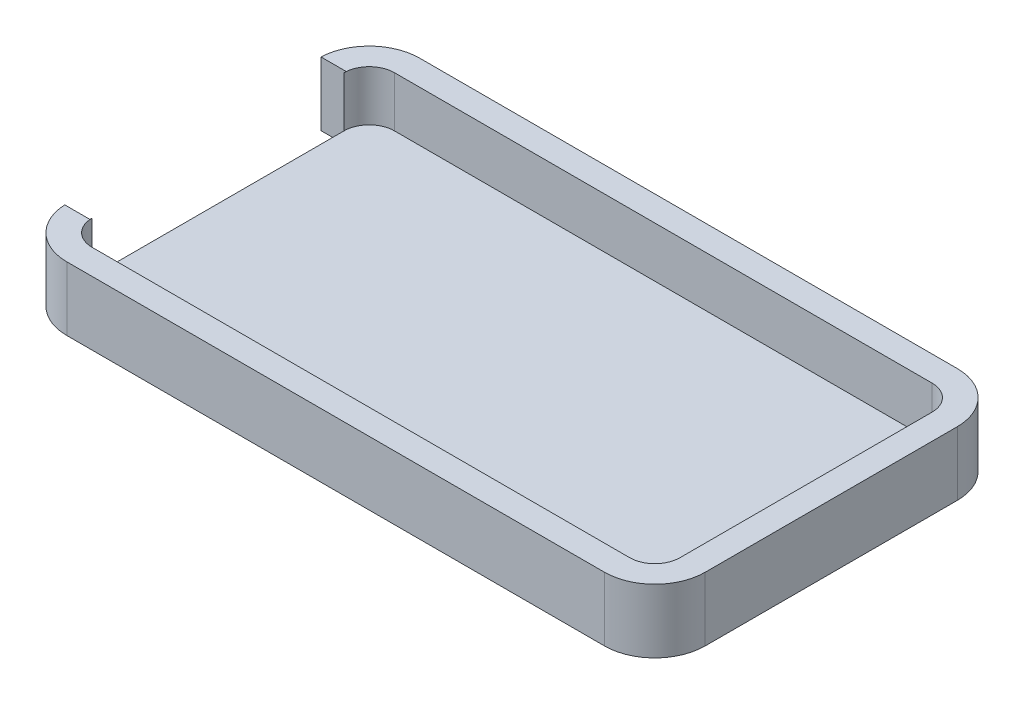
from build123d import *

# Parameters (mm, degrees)
EXTRUDE_3_DEPTH     = 3
EXTRUDE_START       = 0.8
EXTRUDE_4_DEPTH     = 0.8
SKETCH_4_W          = 3
SKETCH_4_H          = 15.25
CUT_EXTRUDE_1_DEPTH = 4


with BuildPart() as part:
    # 草图1 → 凸台-拉伸3 (new body)
    with BuildSketch(Plane(origin=(0, 0, 0), x_dir=(1, 0, 0), z_dir=(0, 1, 0))):
        with BuildLine():
            Line((16, 10.5), (-16, 10.5))
            ThreePointArc((-16, 10.5), (-18.121320344, 9.621320344), (-19, 7.5))
            Line((-19, 7.5), (-19, -7.5))
            ThreePointArc((-19, -7.5), (-18.121320344, -9.621320344), (-16, -10.5))
            Line((-16, -10.5), (16, -10.5))
            ThreePointArc((16, -10.5), (18.121320344, -9.621320344), (19, -7.5))
            Line((19, -7.5), (19, 7.5))
            ThreePointArc((19, 7.5), (18.121320344, 9.621320344), (16, 10.5))
        make_face()
        with BuildLine():
            ThreePointArc((-17.5, 7.5), (-17.060660172, 8.560660172), (-16, 9))
            Line((-16, 9), (16, 9))
            ThreePointArc((16, 9), (17.060660172, 8.560660172), (17.5, 7.5))
            Line((17.5, 7.5), (17.5, 7.313256973))
            Line((17.5, 7.313256973), (17.5, -7.5))
            ThreePointArc((17.5, -7.5), (17.060660172, -8.560660172), (16, -9))
            Line((16, -9), (14.220221891, -9))
            Line((14.220221891, -9), (-14.220221891, -9))
            Line((-14.220221891, -9), (-16, -9))
            ThreePointArc((-16, -9), (-17.060660172, -8.560660172), (-17.5, -7.5))
            Line((-17.5, -7.5), (-17.5, 7.313256973))
            Line((-17.5, 7.313256973), (-17.5, 7.5))
        make_face(mode=Mode.SUBTRACT)
    extrude(amount=EXTRUDE_3_DEPTH)

    # 草图3 → 凸台-拉伸4 (add)
    with BuildSketch(Plane.XZ.offset(EXTRUDE_START)):
        with BuildLine():
            Line((-16, 10.5), (16, 10.5))
            ThreePointArc((16, 10.5), (18.121320344, 9.621320344), (19, 7.5))
            Line((19, 7.5), (19, -7.5))
            ThreePointArc((19, -7.5), (18.121320344, -9.621320344), (16, -10.5))
            Line((16, -10.5), (-16, -10.5))
            ThreePointArc((-16, -10.5), (-18.121320344, -9.621320344), (-19, -7.5))
            Line((-19, -7.5), (-19, 7.5))
            ThreePointArc((-19, 7.5), (-18.121320344, 9.621320344), (-16, 10.5))
        make_face()
    extrude(amount=-EXTRUDE_4_DEPTH)

    # 草图4 → 切除-拉伸1 (cut)
    with BuildSketch(Plane(origin=(0, 3, 0), x_dir=(1, 0, 0), z_dir=(0, 1, 0))):
        with Locations((-19, 0)):
            Rectangle(SKETCH_4_W, SKETCH_4_H)
    extrude(amount=-CUT_EXTRUDE_1_DEPTH, mode=Mode.SUBTRACT)


solid = part.part
